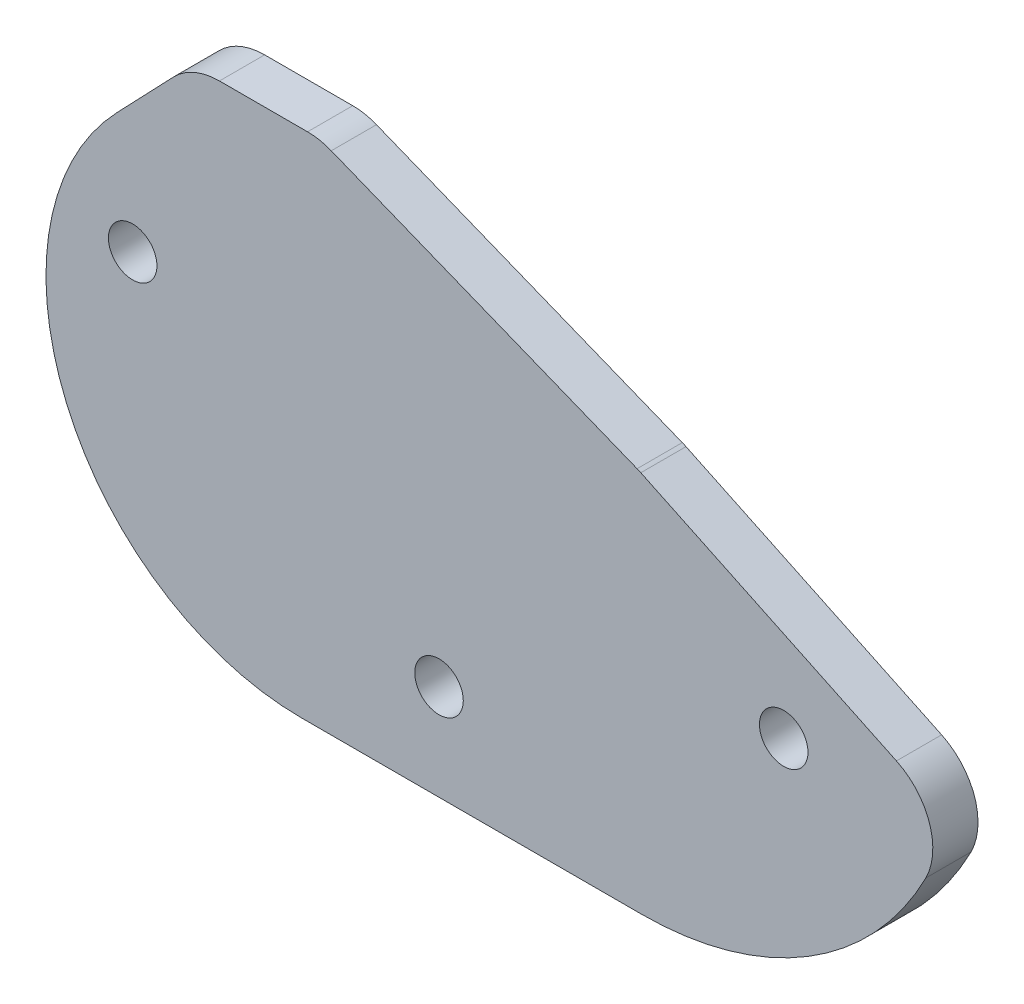
from build123d import *

# Parameters (mm, degrees)
SKETCH1_R          = 2.413
EXTRUDE1_DEPTH     = 4.4958
CUT_EXTRUDE1_DEPTH = 114.681186736
FILLET1_R          = 6.35


with BuildPart() as part:
    # Sketch1 → Extrude1 (new body)
    with BuildSketch(Plane.XY):
        Polygon((26.2420825, 50.8), (0, 23.368), (0, 0), (101.6, 0), (101.6, 23.368), (70.6920825, 38.090460221), (38.9420825, 50.8), align=None)
        with Locations((20.32, 31.75)):
            Circle(SKETCH1_R, mode=Mode.SUBTRACT)
        with Locations((50.8, 9.525)):
            Circle(SKETCH1_R, mode=Mode.SUBTRACT)
        with Locations((85.09, 22.225)):
            Circle(SKETCH1_R, mode=Mode.SUBTRACT)
    extrude(amount=EXTRUDE1_DEPTH)

    # Sketch2 → Cut-Extrude1 (cut, through all)
    with BuildSketch(Plane.XY.offset(4.4958)):
        with BuildLine():
            Line((18.740269579, 42.958025871), (0, 23.368))
            Line((0, 23.368), (0, 0))
            Line((0, 0), (37.094444241, 0))
            ThreePointArc((37.094444241, 0), (13.737070061, 15.420367169), (18.740269579, 42.958025871))
        make_face()
        with BuildLine():
            Line((101.6, 23.368), (101.6, 0))
            Line((101.6, 0), (70.976404914, 0))
            ThreePointArc((70.976404914, 0), (90.236908542, 6.509249219), (101.6, 23.368))
        make_face()
    extrude(amount=-CUT_EXTRUDE1_DEPTH, mode=Mode.SUBTRACT)

    # Fillet1
    # the kernel refuses this fillet: 6.35 mm, written as the material it takes off along each edge
    with BuildSketch(Plane(origin=(26.2420825, 50.8, -6.782726088), x_dir=(-0.6912608610672895, -0.7226053016388058, 0), z_dir=(0, 0, 1))) as fillet1_piece_1:
        with BuildLine():
            CenterArc((FILLET1_R * 0.427258336235, FILLET1_R), FILLET1_R, 223.73, 46.27)
            Line((-FILLET1_R * 0.295346965404, FILLET1_R * 0.308739138933), (0, 0))
            Line((0, 0), (FILLET1_R * 0.427258336235, 0))
        make_face()
    extrude(amount=18.061252175, mode=Mode.SUBTRACT)
    with BuildSketch(Plane(origin=(38.9420825, 50.8, -3.059377728), x_dir=(-1, 0, 0), z_dir=(0, 0, 1))) as fillet1_piece_2:
        with BuildLine():
            CenterArc((FILLET1_R * 0.192716707281, FILLET1_R), FILLET1_R, 248.183751186, 21.816248814)
            Line((-FILLET1_R * 0.178914427547, FILLET1_R * 0.0716195286272), (0, 0))
            Line((0, 0), (FILLET1_R * 0.192716707281, 0))
        make_face()
    extrude(amount=10.614555456, mode=Mode.SUBTRACT)
    with BuildSketch(Plane(origin=(70.6920825, 38.090460221, -0.506345886), x_dir=(-0.9283804713727851, 0.3716311348281322, 0), z_dir=(0, 0, 1))) as fillet1_piece_3:
        with BuildLine():
            CenterArc((FILLET1_R * 0.0318958038441, FILLET1_R), FILLET1_R, 266.346248814, 3.653751186)
            Line((-FILLET1_R * 0.0318309718993, FILLET1_R * 0.00203261673873), (0, 0))
            Line((0, 0), (FILLET1_R * 0.0318958038441, 0))
        make_face()
    extrude(amount=5.508491772, mode=Mode.SUBTRACT)
    with BuildSketch(Plane(origin=(101.6, 23.368, -16.387317761), x_dir=(-0.9028105756982961, 0.43003844526659585, 0), z_dir=(0, 0, 1))) as fillet1_piece_4:
        with BuildLine():
            CenterArc((5.862905037, 6.35), FILLET1_R, 178.312383947, 91.687616053)
            ThreePointArc((-0.484340643, 6.537008757), (-0.411321416, 3.25597162), (0, 0))
            Line((0, 0), (5.862905037, 0))
        make_face()
    extrude(amount=37.270435521, mode=Mode.SUBTRACT)


solid = part.part
